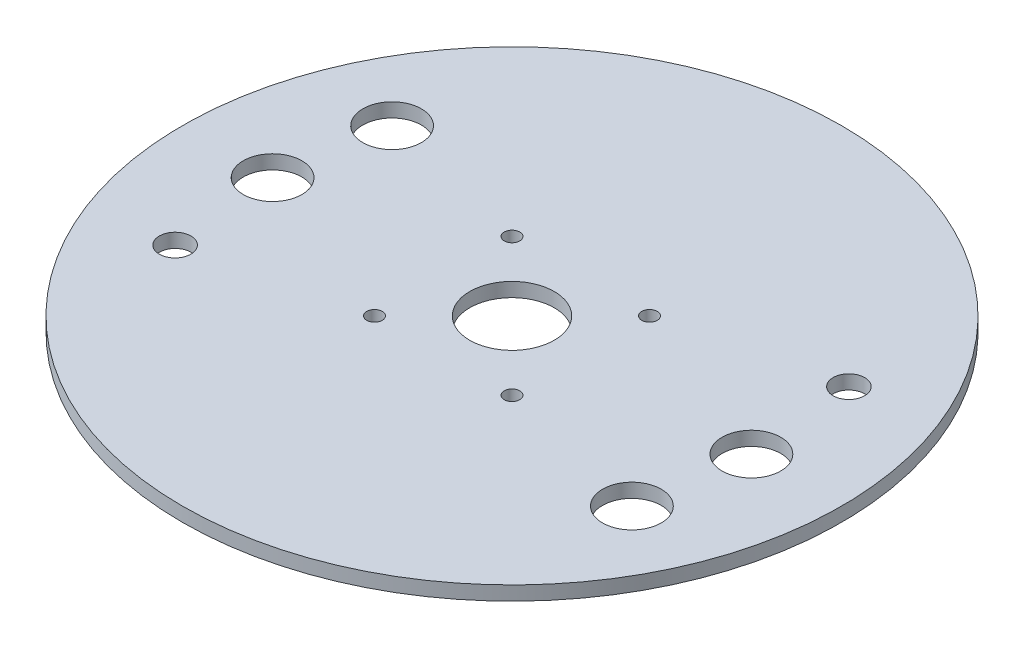
from build123d import *

# Parameters (mm, degrees)
SKETCH1_R           = 74.295
SKETCH1_R_2         = 9.525
BOSS_EXTRUDE1_DEPTH = 3.175
SKETCH2_R           = 6.604
SKETCH2_R_2         = 3.556
CUT_EXTRUDE1_DEPTH  = 3.175
SKETCH3_R           = 1.750000056
SKETCH3_R_2         = 1.75
CUT_EXTRUDE2_DEPTH  = 50.8


with BuildPart() as part:
    # Sketch1 → Boss-Extrude1 (new body)
    with BuildSketch(Plane(origin=(0, 0, 0), x_dir=(1, 0, 0), z_dir=(0, 1, 0))):
        Circle(SKETCH1_R)
        Circle(SKETCH1_R_2, mode=Mode.SUBTRACT)
    extrude(amount=BOSS_EXTRUDE1_DEPTH)

    # Sketch2 → Cut-Extrude1 (cut)
    with BuildSketch(Plane(origin=(0, 3.175, 0), x_dir=(1, 0, 0), z_dir=(0, 1, 0))):
        with Locations((-53.975, 0)):
            Circle(SKETCH2_R)
        with Locations((53.975, 0)):
            Circle(SKETCH2_R)
        with Locations((-51.795490029, -24.152633658)):
            Circle(SKETCH2_R_2)
        with Locations((51.795490029, 24.152633658)):
            Circle(SKETCH2_R_2)
        with Locations((50.64447914, -23.615908466)):
            Circle(SKETCH2_R)
        with Locations((-50.64447914, 23.615908466)):
            Circle(SKETCH2_R)
    extrude(amount=-CUT_EXTRUDE1_DEPTH, mode=Mode.SUBTRACT)

    # Sketch3 → Cut-Extrude2 (cut)
    with BuildSketch(Plane(origin=(0, 3.175, 0), x_dir=(1, 0, 0), z_dir=(0, 1, 0))):
        with Locations((15.5, 15.5)):
            Circle(SKETCH3_R)
        with Locations((15.5, -15.5)):
            Circle(SKETCH3_R)
        with Locations((-15.5, -15.5)):
            Circle(SKETCH3_R)
        with Locations((-15.5, 15.5)):
            Circle(SKETCH3_R_2)
    extrude(amount=-CUT_EXTRUDE2_DEPTH, mode=Mode.SUBTRACT)


solid = part.part
